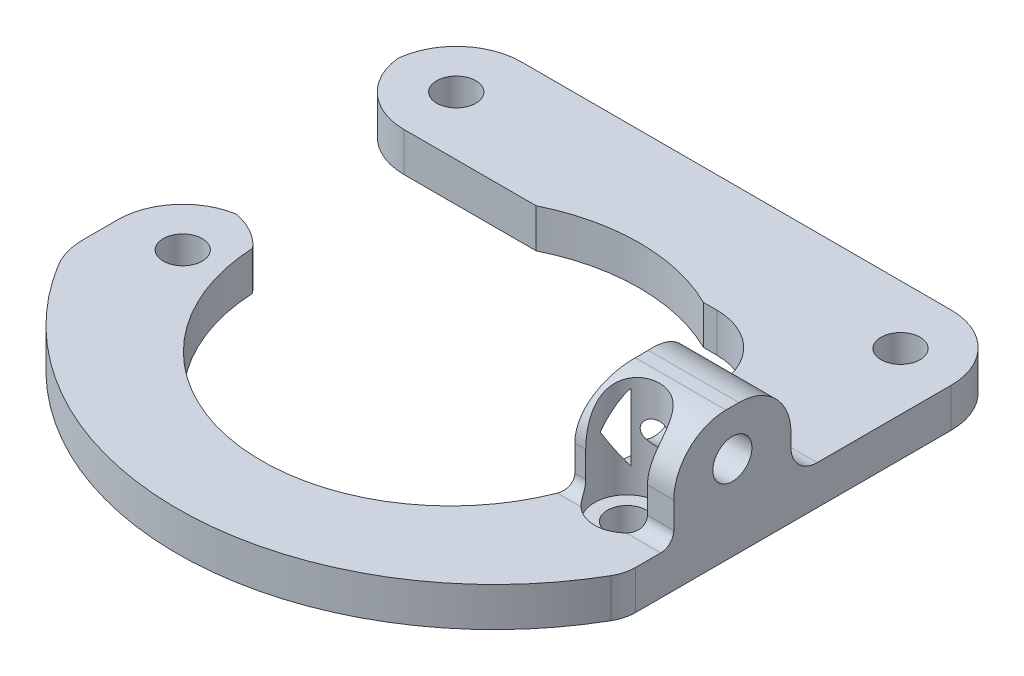
from build123d import *

# Parameters (mm, degrees)
ESQUISSE1_R                  = 1.5
BOSS_EXTRU_1_DEPTH           = 3
CONG_1_R                     = 5
ESQUISSE2_W                  = 9
ESQUISSE2_H                  = 9
BOSS_EXTRU_2_DEPTH           = 7
ESQUISSE3_R                  = 2.5
ENL_V_MAT_EXTRU_1_DEPTH      = 7
ESQUISSE6_R                  = 1.5
ENL_V_MAT_EXTRU_2_DEPTH      = 52.639313998
ENL_V_MAT_EXTRU_3_DEPTH      = 3
CONG_2_R                     = 5
CONG_5_R                     = 2
CONG_7_R                     = 4
CONG_8_R                     = 4
CONG_10_R                    = 1
CONG_11_R                    = 3
ESQUISSE8_R                  = 2.5
ENL_V_MAT_EXTRU_4_DEPTH      = 1
ENL_V_MAT_EXTRU_5_DEPTH      = 58.566971538
ENL_V_MAT_EXTRU_5_DEPTH_BACK = 58.566971538
ESQUISSE9_R                  = 14.5


# Some blends are built 0.0001 mm under size
with BuildPart() as part:
    # Esquisse1 → Boss.-Extru.1 (new body)
    with BuildSketch(Plane(origin=(0, 0, 0), x_dir=(1, 0, 0), z_dir=(0, 1, 0))):
        with BuildLine():
            Line((-43.062018769, 37.558204832), (-43.062018769, 28.558204832))
            Line((-43.062018769, 28.558204832), (-9.062018769, 28.558204832))
            Line((-9.062018769, 28.558204832), (-9.062018769, 16.558204832))
            Line((-9.062018769, 16.558204832), (-10.400687943, 16.558204832))
            ThreePointArc((-10.400687943, 16.558204832), (-22.504500987, 1.48048564), (-34.608314032, 16.558204832))
            Line((-34.608314032, 16.558204832), (-43.062018769, 16.558204832))
            Line((-43.062018769, 16.558204832), (-43.062018769, 7.558204832))
            ThreePointArc((-43.062018769, 7.558204832), (-21.562018769, -5.358424695), (-0.062018769, 7.558204832))
            Line((-0.062018769, 7.558204832), (-0.062018769, 37.558204832))
            Line((-0.062018769, 37.558204832), (-43.062018769, 37.558204832))
        make_face()
        with Locations(Location((-38.562018769, 33.058204832, 0), (0, 0, 270))):
            Circle(ESQUISSE1_R, mode=Mode.SUBTRACT)
        with Locations(Location((-4.452018769, 33.058204832, 0), (0, 0, 270))):
            Circle(ESQUISSE1_R, mode=Mode.SUBTRACT)
        with Locations(Location((-38.562018769, 12.058204832, 0), (0, 0, 270))):
            Circle(ESQUISSE1_R, mode=Mode.SUBTRACT)
        with Locations(Location((-4.452018769, 12.058204832, 0), (0, 0, 270))):
            Circle(ESQUISSE1_R, mode=Mode.SUBTRACT)
    extrude(amount=BOSS_EXTRU_1_DEPTH)

    # Congé1
    # the kernel refuses this fillet: 5 mm, written as the material it takes off along each edge
    with BuildSketch(Plane(origin=(-10.400687943, -7.42198732, -16.558204832), x_dir=(1, 0, 0), z_dir=(0, 1, 0))) as cong_1_piece_1:
        with BuildLine():
            CenterArc((5.289036165, -3.065061278), CONG_1_R, 142.192371197, 36.541408835)
            Line((0.290257108, -2.954571735), (0.190281527, -2.952361944))
            ThreePointArc((0.190281527, -2.952361944), (0.1343702, -1.478342768), (-0.09763425, -0.021622979))
            Line((-0.09763425, -0.021622979), (0, 0.1))
            ThreePointArc((0, 0.1), (0.669334587, 0.1), (1.259661834, 0.061301226))
            Line((1.259661834, 0.061301226), (1.338669174, 0))
        make_face()
    extrude(amount=17.84397464, mode=Mode.SUBTRACT)
    with BuildSketch(Plane(origin=(-34.608314032, -12.844953969, -16.558204832), x_dir=(-0.04210418762599367, 0, 0.9991132255076776), z_dir=(0, 1, 0))) as cong_1_piece_2:
        with BuildLine():
            CenterArc((5.211896668, -4.922904418), CONG_1_R, 100.074581009, 82.338524577)
            Line((0.216330541, -5.133425356), (0.116419218, -5.137635775))
            Line((0.116419218, -5.137635775), (-0.099911323, -0.004210419))
            Line((-0.099911323, -0.004210419), (0.017492994, 0.098458088))
            ThreePointArc((0.017492994, 0.098458088), (2.168623487, -0.091152287), (4.31975398, 0.098458088))
            Line((4.31975398, 0.098458088), (4.337246974, 0))
        make_face()
    extrude(amount=28.689907938, mode=Mode.SUBTRACT)
    with BuildSketch(Plane(origin=(-43.062018769, -12.5, -37.558204832), x_dir=(0, 0, 1), z_dir=(0, 1, 0))) as cong_1_piece_3:
        with BuildLine():
            CenterArc((CONG_1_R, CONG_1_R), CONG_1_R, 180, 90)
            Line((0, CONG_1_R), (-CONG_1_R * 0.02, CONG_1_R))
            Line((-CONG_1_R * 0.02, CONG_1_R), (-CONG_1_R * 0.02, -CONG_1_R * 0.02))
            Line((-CONG_1_R * 0.02, -CONG_1_R * 0.02), (CONG_1_R, -CONG_1_R * 0.02))
            Line((CONG_1_R, -CONG_1_R * 0.02), (CONG_1_R, 0))
        make_face()
    extrude(amount=28, mode=Mode.SUBTRACT)
    with BuildSketch(Plane(origin=(-43.062018769, -12.5, -28.558204832), x_dir=(0, 0, -1), z_dir=(0, 1, 0)), Plane(origin=(-43.062018769, -12.5, -16.558204832), x_dir=(1, 0, 0), z_dir=(0, 1, 0))) as cong_1_piece_4:
        with BuildLine():
            CenterArc((CONG_1_R, -CONG_1_R), CONG_1_R, 90, 90)
            Line((0, -CONG_1_R), (-CONG_1_R * 0.02, -CONG_1_R))
            Line((-CONG_1_R * 0.02, -CONG_1_R), (-CONG_1_R * 0.02, CONG_1_R * 0.02))
            Line((-CONG_1_R * 0.02, CONG_1_R * 0.02), (CONG_1_R, CONG_1_R * 0.02))
            Line((CONG_1_R, CONG_1_R * 0.02), (CONG_1_R, 0))
        make_face()
    extrude(amount=28, mode=Mode.SUBTRACT)
    with BuildSketch(Plane(origin=(-43.062018769, -3.711884718, -7.558204832), x_dir=(0, 0, -1), z_dir=(0, 1, 0))) as cong_1_piece_5:
        with BuildLine():
            CenterArc((1.32357905, -5), CONG_1_R, 90, 31.501244596)
            Line((-1.28900638, -0.736855929), (-1.341258088, -0.651593047))
            ThreePointArc((-1.341258088, -0.651593047), (-0.699748478, -0.271785559), (-0.046958464, 0.088288746))
            Line((-0.046958464, 0.088288746), (0, 0.1))
            Line((0, 0.1), (1.32357905, 0.1))
            Line((1.32357905, 0.1), (1.32357905, 0))
        make_face()
    extrude(amount=10.423769437, mode=Mode.SUBTRACT)

    # Esquisse2 → Boss.-Extru.2 (add)
    with BuildSketch(Plane(origin=(0, 3, 0), x_dir=(1, 0, 0), z_dir=(0, 1, 0))):
        with Locations((-4.562018769, 15.758204832)):
            Rectangle(ESQUISSE2_W, ESQUISSE2_H)
    extrude(amount=BOSS_EXTRU_2_DEPTH)

    # Esquisse3 → Enlèv. mat.-Extru.1 (cut)
    with BuildSketch(Plane(origin=(0, 10, 0), x_dir=(1, 0, 0), z_dir=(0, 1, 0))):
        with Locations((-4.452018769, 12.058204832)):
            Circle(ESQUISSE3_R)
    extrude(amount=-ENL_V_MAT_EXTRU_1_DEPTH, mode=Mode.SUBTRACT)

    # Esquisse6 → Enlèv. mat.-Extru.2 (cut, through all)
    with BuildSketch(Plane.ZY.offset(9.062018769)):
        with Locations((-15.758204832, 6.5)):
            Circle(ESQUISSE6_R)
    extrude(amount=-ENL_V_MAT_EXTRU_2_DEPTH, mode=Mode.SUBTRACT)

    # Esquisse7 → Enlèv. mat.-Extru.3 (cut)
    with BuildSketch(Plane.ZY.offset(9.062018769)):
        Polygon((-14.114150837, 3.649195471), (-12.467308691, 6.49839026), (-14.111362685, 9.349194789), (-17.402258826, 9.350804529), (-19.049100972, 6.50160974), (-17.405046978, 3.650805211), align=None)
    extrude(amount=-ENL_V_MAT_EXTRU_3_DEPTH, mode=Mode.SUBTRACT)

    # Congé2
    cong_2_edges = [part.edges().sort_by_distance(p)[0] for p in [
        (-0.062018769, 1.5, -37.558204832),
        (-9.062018769, 1.5, -28.558204832),
    ]]
    fillet(cong_2_edges, radius=CONG_2_R)

    # Congé5
    cong_5_edges = [part.edges().sort_by_distance(p)[0] for p in [
        (-4.562018769, 3, -20.258204832),
    ]]
    fillet(cong_5_edges, radius=CONG_5_R)

    # Congé7
    cong_7_edges = [part.edges().sort_by_distance(p)[0] for p in [
        (-4.562018769, 10, -20.258204832),
    ]]
    fillet(cong_7_edges, radius=CONG_7_R)

    # Congé8
    cong_8_edges = [part.edges().sort_by_distance(p)[0] for p in [
        (-7.941290697, 10, -11.258204832),
    ]]
    fillet(cong_8_edges, radius=CONG_8_R - 0.0001)  # a hair under: the kernel refuses the full size

    # Congé10
    cong_10_edges = [part.edges().sort_by_distance(p)[0] for p in [
        (-7.941290697, 3, -11.258204832),
        (-1.072746841, 3, -11.258204832),
    ]]
    fillet(cong_10_edges, radius=CONG_10_R)

    # Congé11
    cong_11_edges = [part.edges().sort_by_distance(p)[0] for p in [
        (-0.062018769, 1.5, -7.558204832),
    ]]
    fillet(cong_11_edges, radius=CONG_11_R)

    # Esquisse8 → Enlèv. mat.-Extru.4 (cut)
    with BuildSketch(Plane(origin=(0, 3, 0), x_dir=(1, 0, 0), z_dir=(0, 1, 0))):
        with Locations(Location((-4.452018769, 12.058204832, 0), (0, 0, 270))):
            Circle(ESQUISSE8_R)
    extrude(amount=-ENL_V_MAT_EXTRU_4_DEPTH, mode=Mode.SUBTRACT)

    # Esquisse9 → Enlèv. mat.-Extru.5 (cut, two sides: drawn at the far end of the back side and taken through both)
    with BuildSketch(Plane(origin=(0, 3, 0), x_dir=(1, 0, 0), z_dir=(0, 1, 0)).offset(-ENL_V_MAT_EXTRU_5_DEPTH_BACK)):
        with Locations((-21.507018769, 15.558204832)):
            Circle(ESQUISSE9_R)
    extrude(amount=ENL_V_MAT_EXTRU_5_DEPTH + ENL_V_MAT_EXTRU_5_DEPTH_BACK, mode=Mode.SUBTRACT)


solid = part.part
